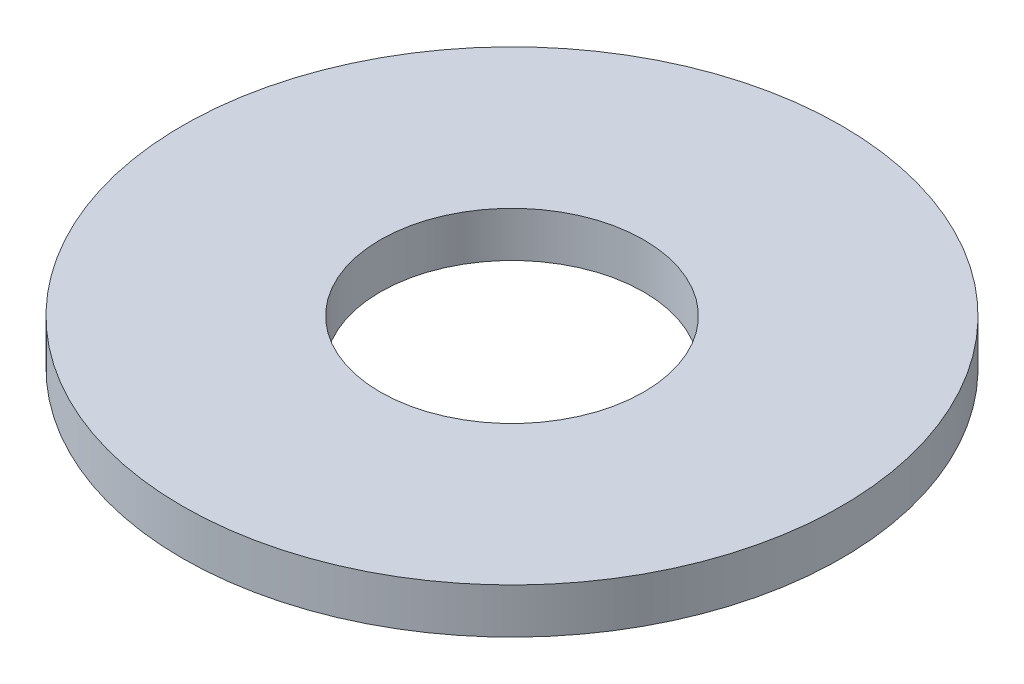
from build123d import *

# Parameters (mm, degrees)
SKETCH1_R           = 87.5
BOSS_EXTRUDE1_DEPTH = 12
SKETCH2_R           = 35
CUT_EXTRUDE1_DEPTH  = 125.324173032


with BuildPart() as part:
    # Sketch1 → Boss-Extrude1 (new body)
    with BuildSketch(Plane(origin=(0, 0, 0), x_dir=(1, 0, 0), z_dir=(0, 1, 0))):
        Circle(SKETCH1_R)
    extrude(amount=BOSS_EXTRUDE1_DEPTH)

    # Sketch2 → Cut-Extrude1 (cut, through all)
    with BuildSketch(Plane(origin=(0, 0, 0), x_dir=(1, 0, 0), z_dir=(0, 1, 0))):
        Circle(SKETCH2_R)
    extrude(amount=CUT_EXTRUDE1_DEPTH, mode=Mode.SUBTRACT)


solid = part.part
